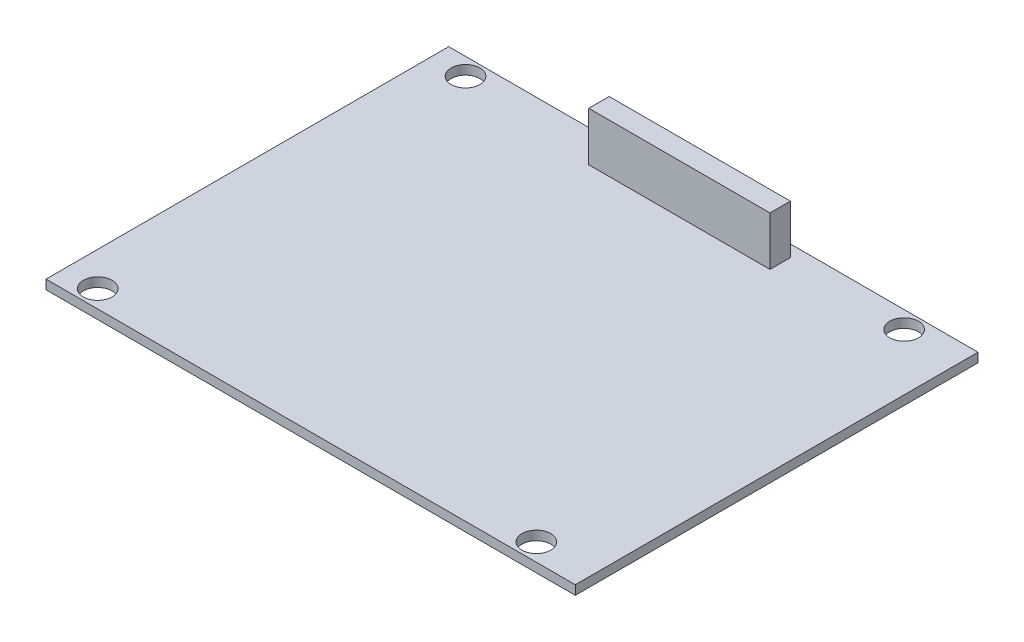
from build123d import *

# Parameters (mm, degrees)
SKETCH1_W           = 92
SKETCH1_H           = 70
SKETCH1_R           = 2.5
Y_PCB_EXTR_DEPTH    = 1.6
SKETCH2_W           = 31.5
SKETCH2_H           = 3.55
Y_HEADER_EXTR_DEPTH = 8.5


with BuildPart() as part:
    # Sketch1 → Y+ PCB extr (new body)
    with BuildSketch(Plane(origin=(0, 0, 0), x_dir=(1, 0, 0), z_dir=(0, 1, 0))):
        with Locations((46, 35)):
            Rectangle(SKETCH1_W, SKETCH1_H)
        with Locations((5.92, 3.07)):
            Circle(SKETCH1_R, mode=Mode.SUBTRACT)
        with Locations((82.16, 3.07)):
            Circle(SKETCH1_R, mode=Mode.SUBTRACT)
        with Locations((82.16, 67)):
            Circle(SKETCH1_R, mode=Mode.SUBTRACT)
        with Locations((5.92, 67)):
            Circle(SKETCH1_R, mode=Mode.SUBTRACT)
    extrude(amount=Y_PCB_EXTR_DEPTH)

    # Sketch2 → Y+ header extr (add)
    with BuildSketch(Plane(origin=(0, 1.6, 0), x_dir=(1, 0, 0), z_dir=(0, 1, 0))):
        with Locations((45.7, 66.165)):
            Rectangle(SKETCH2_W, SKETCH2_H)
    extrude(amount=Y_HEADER_EXTR_DEPTH)


solid = part.part
